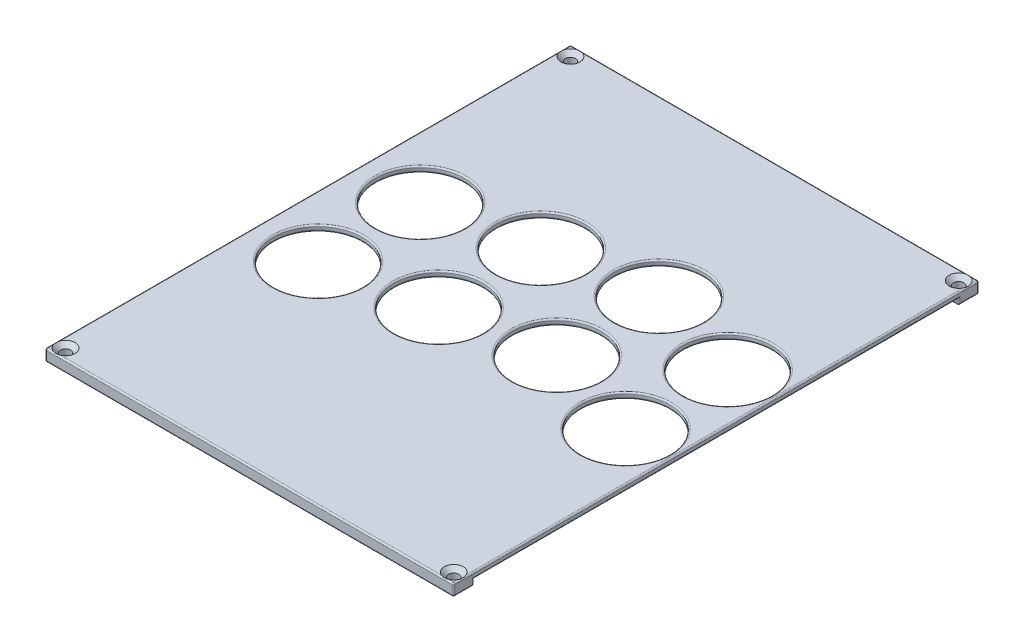
from build123d import *

# Parameters (mm, degrees)
SKETCH1_W           = 140
SKETCH1_H           = 180
SKETCH1_R           = 15.2
SKETCH1_R_2         = 1.75
BOSS_EXTRUDE1_DEPTH = 2
BOSS_EXTRUDE2_START = -2
SKETCH1_4_R         = 1.75
SKETCH1_4_W         = 62
SKETCH1_4_H         = 42
BOSS_EXTRUDE2_DEPTH = 2
CUT_EXTRUDE1_DEPTH  = 0.1
FILLET1_R           = 0.5
CHAMFER1_SIZE       = 1.5


with BuildPart() as part:
    # Sketch1 → Boss-Extrude1 (new body)
    with BuildSketch(Plane(origin=(0, 0, 0), x_dir=(1, 0, 0), z_dir=(0, 1, 0))):
        with Locations((-70, -90)):
            Rectangle(SKETCH1_W, SKETCH1_H)
        with Locations(Location((-119, -72.5, 0), (0, 0, 270))):
            Circle(SKETCH1_R, mode=Mode.SUBTRACT)
        with Locations(Location((-84.707143601, -65.5, 0), (0, 0, 270))):
            Circle(SKETCH1_R, mode=Mode.SUBTRACT)
        with Locations(Location((-50.225264302, -59.5, 0), (0, 0, 270))):
            Circle(SKETCH1_R, mode=Mode.SUBTRACT)
        with Locations(Location((-16.684244639, -69.5, 0), (0, 0, 270))):
            Circle(SKETCH1_R, mode=Mode.SUBTRACT)
        with Locations(Location((-16.684244639, -104.5, 0), (0, 0, 270))):
            Circle(SKETCH1_R, mode=Mode.SUBTRACT)
        with Locations(Location((-50.225264302, -94.5, 0), (0, 0, 270))):
            Circle(SKETCH1_R, mode=Mode.SUBTRACT)
        with Locations(Location((-84.707143601, -100.5, 0), (0, 0, 270))):
            Circle(SKETCH1_R, mode=Mode.SUBTRACT)
        with Locations(Location((-119, -107.5, 0), (0, 0, 270))):
            Circle(SKETCH1_R, mode=Mode.SUBTRACT)
        with Locations(Location((-136.5, -3.5, 0), (0, 0, 270))):
            Circle(SKETCH1_R_2, mode=Mode.SUBTRACT)
        with Locations(Location((-3.5, -3.5, 0), (0, 0, 270))):
            Circle(SKETCH1_R_2, mode=Mode.SUBTRACT)
        with Locations(Location((-3.5, -176.5, 0), (0, 0, 270))):
            Circle(SKETCH1_R_2, mode=Mode.SUBTRACT)
        with Locations(Location((-136.5, -176.5, 0), (0, 0, 270))):
            Circle(SKETCH1_R_2, mode=Mode.SUBTRACT)
    extrude(amount=BOSS_EXTRUDE1_DEPTH)

    # Sketch1<4> → Boss-Extrude2 (add)
    # profile 1 of 2: a face of its own
    with BuildSketch(Plane(origin=(0, 0, 0), x_dir=(1, 0, 0), z_dir=(0, 1, 0)).offset(BOSS_EXTRUDE2_START)):
        Polygon((0, -7), (0, 0), (-140, 0), (-140, -180), (0, -180), (0, -173), (-7, -173), (-7, -178), (-133, -178), (-133, -173), (-138, -173), (-138, -7), (-133, -7), (-133, -2), (-7, -2), (-7, -7), align=None)
        with Locations(Location((-136.5, -176.5, 0), (0, 0, 270))):
            Circle(SKETCH1_4_R, mode=Mode.SUBTRACT)
        with Locations(Location((-3.5, -176.5, 0), (0, 0, 270))):
            Circle(SKETCH1_4_R, mode=Mode.SUBTRACT)
        with Locations(Location((-136.5, -3.5, 0), (0, 0, 270))):
            Circle(SKETCH1_4_R, mode=Mode.SUBTRACT)
        with Locations(Location((-3.5, -3.5, 0), (0, 0, 270))):
            Circle(SKETCH1_4_R, mode=Mode.SUBTRACT)
    # profile 2 of 2: a face of its own
    with BuildSketch(Plane(origin=(0, 0, 0), x_dir=(1, 0, 0), z_dir=(0, 1, 0)).offset(BOSS_EXTRUDE2_START)):
        with Locations((-70, -145)):
            Rectangle(SKETCH1_4_W, SKETCH1_4_H)
        Polygon((-96.316431948, -130.05), (-95.132863896, -128), (-96.316431948, -125.95), (-98.683568052, -125.95), (-99.867136104, -128), (-98.683568052, -130.05), align=None, mode=Mode.SUBTRACT)
        Polygon((-41.316431948, -130.05), (-40.132863896, -128), (-41.316431948, -125.95), (-43.683568052, -125.95), (-44.867136104, -128), (-43.683568052, -130.05), align=None, mode=Mode.SUBTRACT)
        Polygon((-43.683568052, -164.05), (-41.316431948, -164.05), (-40.132863896, -162), (-41.316431948, -159.95), (-43.683568052, -159.95), (-44.867136104, -162), align=None, mode=Mode.SUBTRACT)
        Polygon((-96.316431948, -164.05), (-95.132863896, -162), (-96.316431948, -159.95), (-98.683568052, -159.95), (-99.867136104, -162), (-98.683568052, -164.05), align=None, mode=Mode.SUBTRACT)
    extrude(amount=BOSS_EXTRUDE2_DEPTH)

    # Sketch2 → Cut-Extrude1 (cut)
    with BuildSketch(Plane(origin=(0, 0, 0), x_dir=(0, 0, -1), z_dir=(1, 0, 0))):
        Polygon((-173, -2), (-173, 0), (-7, 0), (-7, -2), (0, -2), (0, 2), (-180, 2), (-180, -2), align=None)
    extrude(amount=-CUT_EXTRUDE1_DEPTH, mode=Mode.SUBTRACT)

    # Fillet1
    fillet1_edges = [part.edges().sort_by_distance(p)[0] for p in [
        (-133, -2, 175.5),
        (-133, -1, 173),
        (-7, -2, 175.5),
        (-7, -1, 173),
        (-140, -2, 90),
        (-3.55, -2, 7),
        (-7, -2, 4.5),
        (-7, -1, 7),
        (-70, -2, 2),
        (-133, -1, 7),
        (-135.5, -2, 173),
        (-136.5, -2, 174.75),
        (-3.5, -2, 174.75),
        (-3.5, -2, 1.75),
        (-136.5, -2, 1.75),
        (-70, -2, 178),
        (-133, -2, 4.5),
        (-135.5, -2, 7),
        (-138, -2, 90),
        (-70, -2, 166),
        (-39, -1, 166),
        (-101, -1, 166),
        (-101, -1, 124),
        (-39, -2, 145),
        (-39, -1, 124),
        (-95.724647922, -2, 129.025),
        (-95.724647922, -2, 126.975),
        (-97.5, -2, 125.95),
        (-99.275352078, -2, 126.975),
        (-99.275352078, -2, 129.025),
        (-97.5, -2, 130.05),
        (-40.724647922, -2, 129.025),
        (-40.724647922, -2, 126.975),
        (-42.5, -2, 125.95),
        (-44.275352078, -2, 126.975),
        (-44.275352078, -2, 129.025),
        (-42.5, -2, 130.05),
        (-42.5, -2, 164.05),
        (-40.724647922, -2, 163.025),
        (-40.724647922, -2, 160.975),
        (-42.5, -2, 159.95),
        (-44.275352078, -2, 160.975),
        (-44.275352078, -2, 163.025),
        (-95.724647922, -2, 163.025),
        (-95.724647922, -2, 160.975),
        (-97.5, -2, 159.95),
        (-99.275352078, -2, 160.975),
        (-99.275352078, -2, 163.025),
        (-97.5, -2, 164.05),
        (-101, -2, 145),
        (-70, -2, 124),
        (-3.55, -2, 173),
        (-70.05, -2, 180),
        (-70.05, -2, 0),
        (-70.05, 2, 0),
        (-70.05, 2, 180),
        (-0.1, -1, 173),
        (-0.1, -2, 176.5),
        (-0.1, 0, 180),
        (-0.1, 2, 90),
        (-0.1, 0, 0),
        (-0.1, -2, 3.5),
        (-0.1, -1, 7),
        (-0.1, 0, 90),
        (-140, 2, 90),
        (-119, 2, 92.3),
        (-84.707143601, 2, 85.3),
        (-119, 0, 57.3),
        (-50.225264302, 2, 79.3),
        (-84.707143601, 0, 50.3),
        (-50.225264302, 0, 44.3),
        (-16.684244639, 0, 54.3),
        (-16.684244639, 0, 89.3),
        (-50.225264302, 0, 79.3),
        (-84.707143601, 0, 85.3),
        (-119, 0, 92.3),
        (-16.684244639, 2, 89.3),
        (-16.684244639, 2, 54.3),
        (-50.225264302, 2, 44.3),
        (-140, 0, 180),
        (-140, 0, 0),
        (-84.707143601, 2, 50.3),
        (-119, 2, 57.3),
    ]]
    fillet(fillet1_edges, radius=FILLET1_R)

    # Chamfer1
    # the kernel refuses this chamfer: 1.5 mm, written as the material it takes off along each edge
    with BuildSketch(Plane(origin=(-136.5, 2, 176.5), x_dir=(0, 0, 1), z_dir=(-1, 0, 0))) as chamfer1_piece_1:
        Polygon((1.75 + CHAMFER1_SIZE, 0), (1.75, -CHAMFER1_SIZE), (1.75, 0), align=None)
    revolve(axis=Axis((-136.5, 2, 176.5), (0, 1, 0)), mode=Mode.SUBTRACT)
    with BuildSketch(Plane(origin=(-3.5, 2, 176.5), x_dir=(0, 0, 1), z_dir=(-1, 0, 0))) as chamfer1_piece_2:
        Polygon((1.75 + CHAMFER1_SIZE, 0), (1.75, -CHAMFER1_SIZE), (1.75, 0), align=None)
    revolve(axis=Axis((-3.5, 2, 176.5), (0, 1, 0)), mode=Mode.SUBTRACT)
    with BuildSketch(Plane(origin=(-3.5, 2, 3.5), x_dir=(0, 0, 1), z_dir=(-1, 0, 0))) as chamfer1_piece_3:
        Polygon((1.75 + CHAMFER1_SIZE, 0), (1.75, -CHAMFER1_SIZE), (1.75, 0), align=None)
    revolve(axis=Axis((-3.5, 2, 3.5), (0, 1, 0)), mode=Mode.SUBTRACT)
    with BuildSketch(Plane(origin=(-136.5, 2, 3.5), x_dir=(0, 0, 1), z_dir=(-1, 0, 0))) as chamfer1_piece_4:
        Polygon((1.75 + CHAMFER1_SIZE, 0), (1.75, -CHAMFER1_SIZE), (1.75, 0), align=None)
    revolve(axis=Axis((-136.5, 2, 3.5), (0, 1, 0)), mode=Mode.SUBTRACT)


solid = part.part
